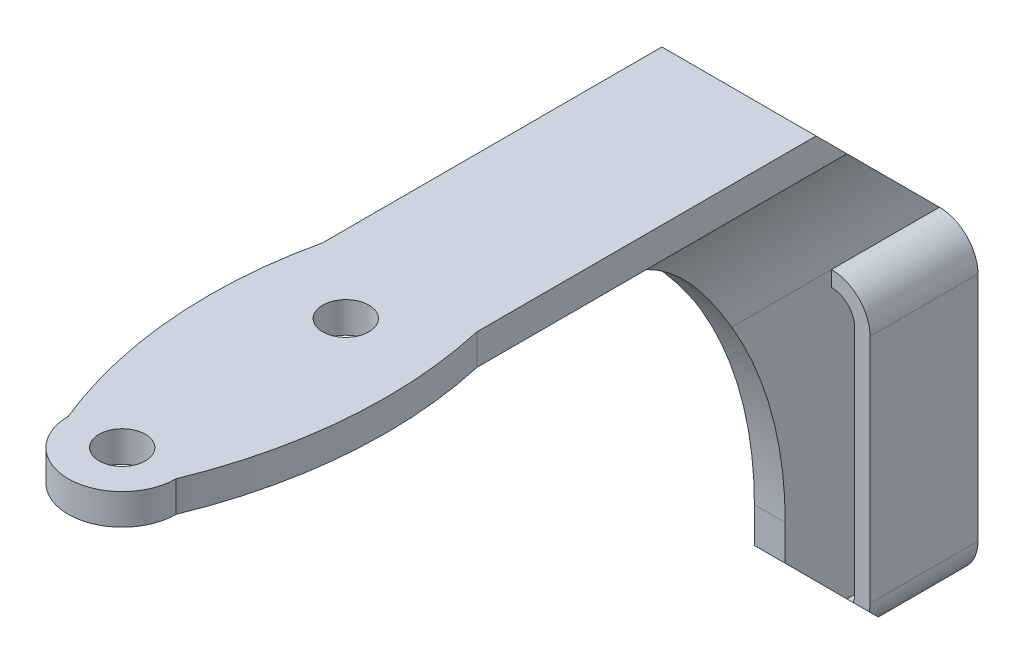
from build123d import *

# Parameters (mm, degrees)
SKETCH1_W           = 10
SKETCH1_H           = 22
SKETCH1_R           = 1.5
SKETCH1_R_2         = 3.5
BOSS_EXTRUDE1_DEPTH = 2
BOSS_EXTRUDE2_DEPTH = 10
CUT_EXTRUDE1_REACH  = 62.656
BOSS_EXTRUDE3_DEPTH = 7
CHAMFER1_SIZE       = 5


with BuildPart() as part:
    # Sketch1 → Boss-Extrude1 (new body)
    # profile 1 of 3: a face of its own
    with BuildSketch(Plane(origin=(0, 0, 0), x_dir=(1, 0, 0), z_dir=(0, 1, 0))):
        with Locations((0, 29)):
            Rectangle(SKETCH1_W, SKETCH1_H)
    # profile 2 of 3: a face of its own
    with BuildSketch(Plane(origin=(0, 0, 0), x_dir=(1, 0, 0), z_dir=(0, 1, 0))):
        with BuildLine():
            Line((5, 18), (-5, 18))
            ThreePointArc((-5, 18), (-5.636846209, 8.884429483), (-3.5, 0))
            ThreePointArc((-3.5, 0), (0, 3.5), (3.5, 0))
            ThreePointArc((3.5, 0), (5.636846209, 8.884429483), (5, 18))
        make_face()
        with Locations(Location((0, 14.5, 0), (0, 0, 270))):
            Circle(SKETCH1_R, mode=Mode.SUBTRACT)
    # profile 3 of 3: a face of its own
    with BuildSketch(Plane(origin=(0, 0, 0), x_dir=(1, 0, 0), z_dir=(0, 1, 0))):
        Circle(SKETCH1_R_2)
        with Locations(Location((0, 0, 0), (0, 0, 270))):
            Circle(SKETCH1_R, mode=Mode.SUBTRACT)
    extrude(amount=BOSS_EXTRUDE1_DEPTH)

    # Sketch2 → Boss-Extrude2 (add)
    with BuildSketch(Plane.ZY.offset(5)):
        with BuildLine():
            Line((-40, 2), (-50, -8))
            Line((-50, -8), (-50, -28))
            Line((-50, -28), (-40, -28))
            Line((-40, -28), (-40, -20.712315177))
            ThreePointArc((-40, -20.712315177), (-37.079402166, -8.986275778), (-29, 0))
            Line((-29, 0), (-40, 2))
        make_face()
    extrude(amount=-BOSS_EXTRUDE2_DEPTH)

    # Sketch3 → Cut-Extrude1 (cut, up to next)
    with BuildSketch(Plane(origin=(0, 0, -50), x_dir=(-1, 0, 0), z_dir=(0, 0, -1)), mode=Mode.PRIVATE) as cut_extrude1_sk1:
        with BuildLine():
            Line((-3, -8), (-3, -28))
            Line((-3, -28), (-5, -28))
            Line((-5, -28), (-5, 0))
            ThreePointArc((-5, 0), (-3.507577498, -3.876894374), (-3, -8))
        make_face()
    cut_extrude1_tool1 = extrude(cut_extrude1_sk1.sketch, amount=-CUT_EXTRUDE1_REACH, mode=Mode.PRIVATE) & part.part
    # Sketch3 → Cut-Extrude1 (cut, up to next)
    with BuildSketch(Plane(origin=(0, 0, -50), x_dir=(-1, 0, 0), z_dir=(0, 0, -1)), mode=Mode.PRIVATE) as cut_extrude1_sk2:
        with BuildLine():
            Line((-1, -8), (-1, -28))
            Line((-1, -28), (5, -28))
            Line((5, -28), (5, 0))
            ThreePointArc((5, 0), (0.666666667, -3), (-1, -8))
        make_face()
    cut_extrude1_tool2 = extrude(cut_extrude1_sk2.sketch, amount=-CUT_EXTRUDE1_REACH, mode=Mode.PRIVATE) & part.part
    add(cut_extrude1_tool1.solids().sort_by_distance((4.041628, -15.231137, -50))[0], mode=Mode.SUBTRACT)
    add(cut_extrude1_tool2.solids().sort_by_distance((-2.115152, -14.990475, -50))[0], mode=Mode.SUBTRACT)

    # Sketch4 → Boss-Extrude3 (add)
    with BuildSketch(Plane(origin=(0, 0, -50), x_dir=(-1, 0, 0), z_dir=(0, 0, -1))):
        with BuildLine():
            ThreePointArc((-3, -8), (-4.767766953, -8.732233047), (-5.5, -10.5))
            Line((-5.5, -10.5), (-5.5, -25.5))
            ThreePointArc((-5.5, -25.5), (-4.767766953, -27.267766953), (-3, -28))
            Line((-3, -28), (-3, -27))
            ThreePointArc((-3, -27), (-4.060660172, -26.560660172), (-4.5, -25.5))
            Line((-4.5, -25.5), (-4.5, -10.5))
            ThreePointArc((-4.5, -10.5), (-4.060660172, -9.439339828), (-3, -9))
            Line((-3, -9), (-3, -8))
        make_face()
    extrude(amount=-BOSS_EXTRUDE3_DEPTH)

    # Chamfer1
    # the kernel refuses this chamfer: 5 mm, written as the material it takes off along each edge
    with BuildSketch(Plane(origin=(-11.85841494, -28, -40), x_dir=(0, 0.9996219169112968, 0.027495876610586317), z_dir=(1, 0, 0))) as chamfer1_piece_1:
        Polygon((CHAMFER1_SIZE * 0.999621916911, -CHAMFER1_SIZE * 0.0274958766106), (-CHAMFER1_SIZE * 0.0274958766106, -CHAMFER1_SIZE * 0.999621916911), (0, 0), align=None)
    extrude(amount=27.71682988, mode=Mode.SUBTRACT)


solid = part.part
